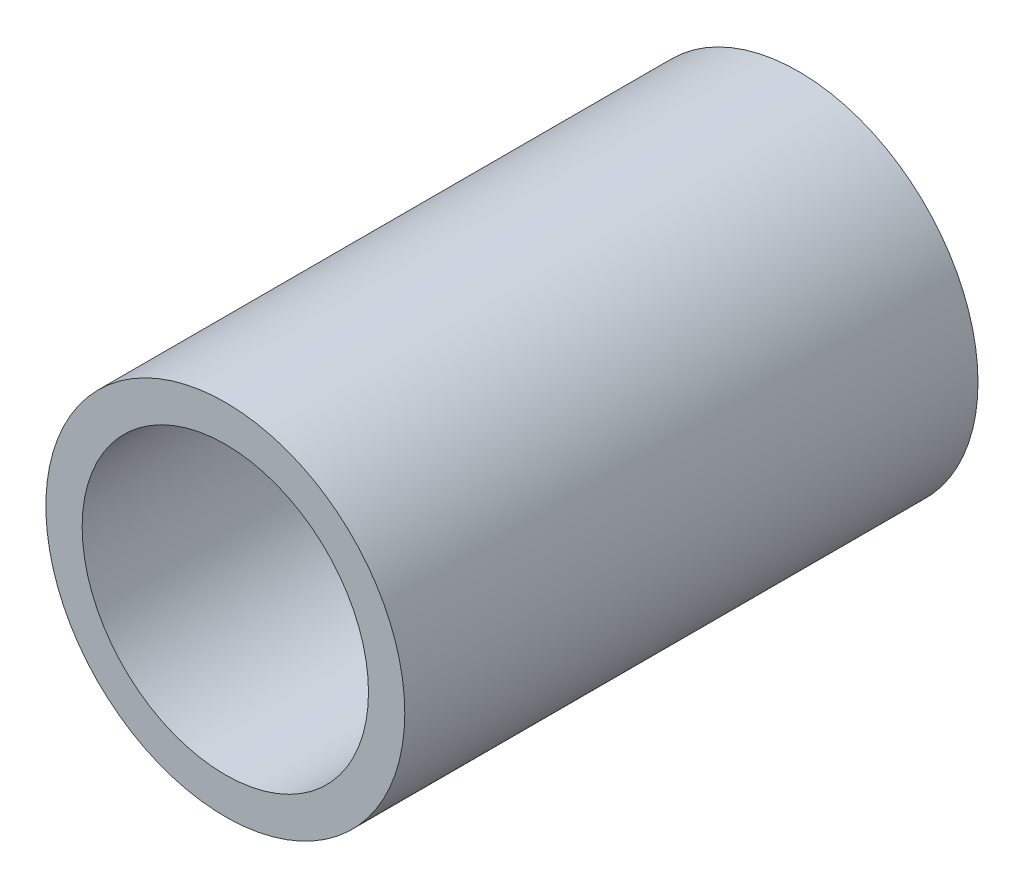
from build123d import *

# Parameters (mm, degrees)
SKETCH1_R           = 16.7005
SKETCH1_R_2         = 13.3223
EXTRUDE_THIN1_DEPTH = 26.67


with BuildPart() as part:
    # Sketch1 → Extrude-Thin1 (new, symmetric)
    with BuildSketch(Plane.XY):
        Circle(SKETCH1_R)
        Circle(SKETCH1_R_2, mode=Mode.SUBTRACT)
    extrude(amount=EXTRUDE_THIN1_DEPTH, both=True)


solid = part.part
